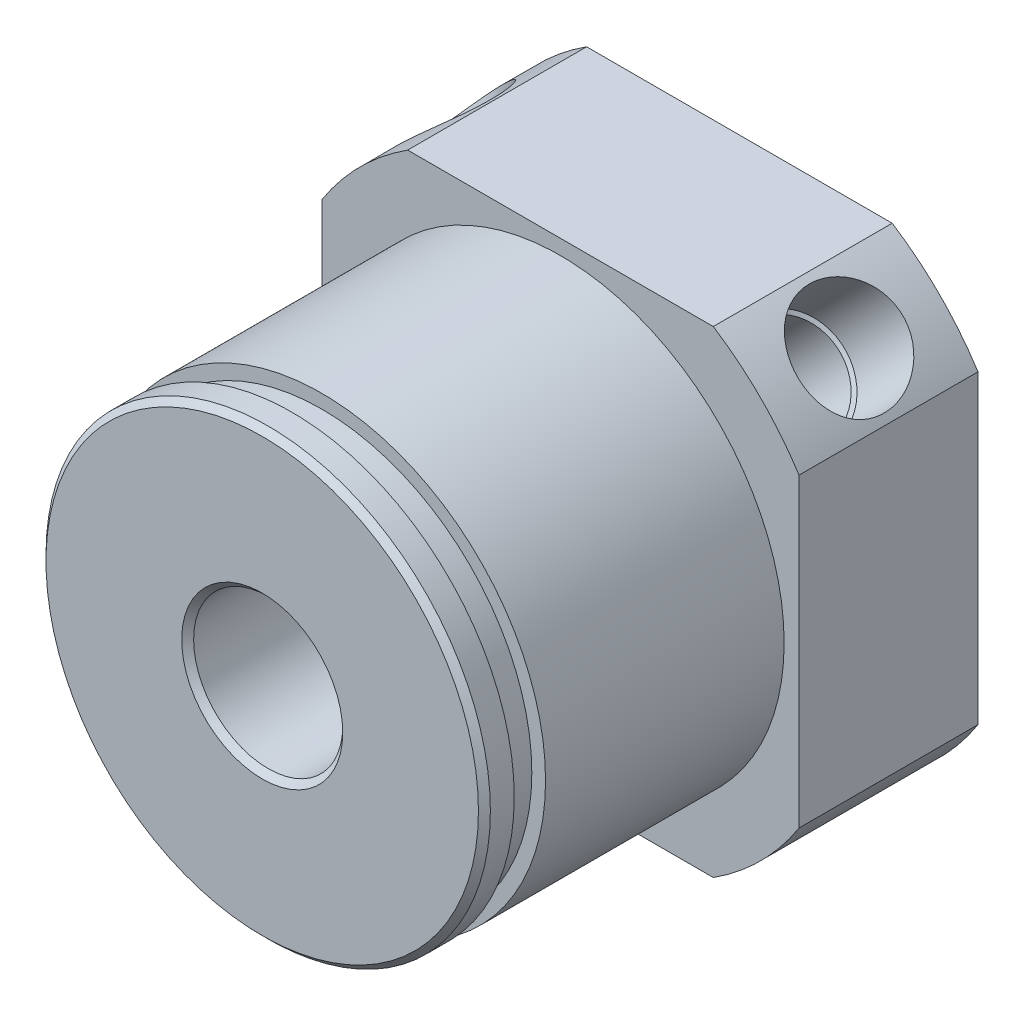
from build123d import *

# Parameters (mm, degrees)
BOSS_EXTRUDE1_DEPTH         = 7.62
CUT_EXTRUDE1_START          = 1.523953
CUT_EXTRUDE1_DEPTH          = 0.508
F_1_4_0_25_DIAMETER_HOLE1_D = 6.35
CHAMFER1_SIZE               = 0.254


# Read off the part's stored shape, not the designer's step: CSK for #6 Flat Head Machine Screw (100)1, CSK for #6 Flat Head Machine Screw (100)2
with BuildPart() as part:
    # Sketch1 → Boss-Extrude1 (new body)
    with BuildSketch(Plane(origin=(0, 0, 0), x_dir=(-1, 0, 0), z_dir=(0, 0, -1))):
        with BuildLine():
            Line((10.16, -6.506813736), (10.16, 6.506813736))
            ThreePointArc((10.16, 6.506813736), (8.531243315, 8.531243315), (6.506813736, 10.16))
            Line((6.506813736, 10.16), (-6.506813736, 10.16))
            ThreePointArc((-6.506813736, 10.16), (-8.531243315, 8.531243315), (-10.16, 6.506813736))
            Line((-10.16, 6.506813736), (-10.16, -6.506813736))
            ThreePointArc((-10.16, -6.506813736), (-8.531243315, -8.531243315), (-6.506813736, -10.16))
            Line((-6.506813736, -10.16), (6.506813736, -10.16))
            ThreePointArc((6.506813736, -10.16), (8.531243315, -8.531243315), (10.16, -6.506813736))
        make_face()
    extrude(amount=-BOSS_EXTRUDE1_DEPTH)

    # Sketch2 → Cut-Extrude1 (cut)
    with BuildSketch(Plane(origin=(0, 0, 1.523952559), x_dir=(-1, 0, 0), z_dir=(0, 0, -1)).offset(CUT_EXTRUDE1_START)):
        with BuildLine():
            Line((1.889125, -8.001), (1.158875, -8.001))
            add(Edge.make_bspline(
                [(1.158875, -8.001), (1.158872937, -8.044475215), (1.158868812, -8.131425646), (1.158899751, -8.261853836), (1.158782182, -8.392271851), (1.159221519, -8.522728024), (1.157581766, -8.65303983), (1.163686315, -8.783563395), (1.131096282, -8.911728677), (1.058473502, -9.021898611), (0.953640515, -9.101760404), (0.829437405, -9.145385371), (0.697588706, -9.145896155), (0.573131645, -9.103398602), (0.467813448, -9.024298708), (0.394265073, -8.914779016), (0.360421234, -8.786730663), (0.366393811, -8.655863654), (0.36478471, -8.525077993), (0.365216149, -8.394030645), (0.365100694, -8.26302727), (0.365131077, -8.132012169), (0.365127026, -8.044670723), (0.365125, -8.001)],
                knots=[0, 0, 0, 0, 0.04771921, 0.095438419, 0.143157629, 0.190876839, 0.238596048, 0.286313163, 0.333682366, 0.381043764, 0.428414282, 0.475836339, 0.523086151, 0.570387621, 0.617736793, 0.665150189, 0.712504193, 0.760330872, 0.808264698, 0.856198523, 0.904132349, 0.952066174, 1, 1, 1, 1], degree=3))
            Line((0.365125, -8.001), (-1.889125, -8.001))
            add(Edge.make_bspline(
                [(-1.889125, -8.001), (-1.889114812, -8.051894525), (-1.889094436, -8.153683576), (-1.889247255, -8.306368158), (-1.888666545, -8.459048717), (-1.890836563, -8.611744064), (-1.882759373, -8.763965749), (-1.914911349, -8.916005254), (-2.006583536, -9.041712954), (-2.136758982, -9.125851008), (-2.289345509, -9.153077401), (-2.441459117, -9.123368959), (-2.569808734, -9.037082272), (-2.65983821, -8.910286231), (-2.688880942, -8.757615863), (-2.681256155, -8.60511048), (-2.683310175, -8.451698443), (-2.682753256, -8.298343213), (-2.682926802, -8.144961863), (-2.682789537, -7.991619884), (-2.683165051, -7.838146541), (-2.681801975, -7.685351504), (-2.686853196, -7.53117355), (-2.628890851, -7.38497772), (-2.521046133, -7.273065177), (-2.378348767, -7.206351642), (-2.223808502, -7.207490017), (-2.072112792, -7.207185716), (-1.919779713, -7.207267225), (-1.767631713, -7.207245385), (-1.615434122, -7.207251236), (-1.463249814, -7.20724967), (-1.311061964, -7.207250082), (-1.209603988, -7.207250027), (-1.158875, -7.20725)],
                knots=[0, 0, 0, 0, 0.031320452, 0.062640904, 0.093961356, 0.125281809, 0.156602077, 0.187665627, 0.218747437, 0.249771849, 0.28082955, 0.311809013, 0.342800401, 0.373834649, 0.404881688, 0.436337896, 0.467799211, 0.499260526, 0.530721841, 0.562183156, 0.593644471, 0.625105786, 0.656448512, 0.68765108, 0.718839254, 0.750218434, 0.781469964, 0.81268854, 0.843907117, 0.875125693, 0.90634427, 0.937562847, 0.968781423, 1, 1, 1, 1], degree=3))
            add(Edge.make_bspline(
                [(-1.158875, -7.20725), (-1.158873643, -7.162894388), (-1.158870928, -7.074183165), (-1.158891289, -6.941111847), (-1.158813917, -6.808058432), (-1.159103046, -6.674937496), (-1.158160413, -6.542105789), (-1.162792352, -6.40859388), (-1.123081204, -6.279296809), (-1.043328982, -6.17099473), (-0.932633409, -6.094593309), (-0.802795792, -6.059099197), (-0.668632801, -6.067681678), (-0.544609192, -6.120335348), (-0.445331921, -6.210309856), (-0.378114798, -6.328380261), (-0.369456887, -6.416856776), (-0.365125, -6.461125)],
                knots=[0, 0, 0, 0, 0.066968294, 0.133936588, 0.200904882, 0.267873219, 0.334841936, 0.401752492, 0.468337617, 0.534646563, 0.601246412, 0.66759139, 0.734141278, 0.800523112, 0.867014877, 0.933462398, 1, 1, 1, 1], degree=3))
            Line((-0.365125, -6.461125), (-0.365125, -7.20725))
            add(Edge.make_bspline(
                [(-0.365125, -7.20725), (-0.31073924, -7.20725), (-0.20196772, -7.20725), (-0.03881044, -7.20725), (0.124346841, -7.20725), (0.287504121, -7.20725), (0.450661401, -7.207250001), (0.61381868, -7.207249996), (0.776975966, -7.207250014), (0.940133226, -7.207249949), (1.103290581, -7.207250189), (1.26644758, -7.207249293), (1.42960591, -7.207252638), (1.59275927, -7.207240153), (1.755931181, -7.207286749), (1.91903386, -7.207112852), (2.082398735, -7.207761857), (2.244713636, -7.205340907), (2.410623595, -7.213297949), (2.556377817, -7.298886101), (2.658013084, -7.432947287), (2.689729238, -7.59799594), (2.681031241, -7.762226985), (2.683361321, -7.927506447), (2.682773435, -8.092675694), (2.682794937, -8.257881374), (2.683296815, -8.423048668), (2.68126756, -8.588352833), (2.688866329, -8.75283629), (2.658381139, -8.918643331), (2.555396264, -9.053764707), (2.408701771, -9.136770112), (2.2405432, -9.153020414), (2.080098519, -9.09990658), (1.955237034, -8.986695), (1.885247755, -8.831155243), (1.890172169, -8.664016711), (1.888843871, -8.498928973), (1.889199968, -8.332843432), (1.889106258, -8.166945119), (1.889118753, -8.05631504), (1.889125, -8.001)],
                knots=[0, 0, 0, 0, 0.025504461, 0.051008922, 0.076513383, 0.102017844, 0.127522304, 0.153026765, 0.178531226, 0.204035687, 0.229540148, 0.255044609, 0.28054907, 0.306053531, 0.331557991, 0.357062452, 0.382566913, 0.408073163, 0.433537274, 0.459042456, 0.484570707, 0.510085466, 0.535909525, 0.561732239, 0.587554953, 0.613377667, 0.639200381, 0.665023095, 0.690855069, 0.716494274, 0.742192433, 0.767783402, 0.793488921, 0.819098849, 0.844763736, 0.870443974, 0.896243874, 0.922182905, 0.948121937, 0.974060968, 1, 1, 1, 1], degree=3))
        make_face()
    extrude(amount=-CUT_EXTRUDE1_DEPTH, mode=Mode.SUBTRACT)

    # Sketch3 → Revolve1 (revolve)
    with BuildSketch(Plane.XZ, mode=Mode.PRIVATE) as revolve1_sk:
        Polygon((9.4615, 20.32), (0, 20.32), (0, 7.62), (9.525, 7.62), (9.525, 17.78), (8.9408, 17.78), (8.9408, 19.05), (9.4615, 19.05), align=None)
    revolve(revolve1_sk.sketch.rotate(Axis((0, 0, 20.32), (0, 0, -1)), 180), axis=Axis((0, 0, 20.32), (0, 0, -1)))

    # 1/4 (0.25) Diameter Hole1 (through all)
    with Locations(Plane(origin=(0, 0, 0), x_dir=(-1, 0, 0), z_dir=(0, 0, -1))):
        with Locations((0, 0)):
            Hole(F_1_4_0_25_DIAMETER_HOLE1_D / 2)

    # CSK for _6 Flat Head Machine Screw _ 2 → CSK for _6 Flat Head Machine Screw _100 (revolve, cut)
    with BuildSketch(Plane(origin=(0, 0, 3.81), x_dir=(0.7071067811866009, 0.7071067811864942, 0), z_dir=(0, 0, -1))):
        Polygon((2.0828, -8.509), (2.0828, -2.395972613), (0, -2.395972613), (0, -12.065031051), (2.2479, -12.065031051), (2.2479, -8.577386659), align=None)
    revolve(axis=Axis((0, 0, 3.81), (0.7071067811864942, -0.7071067811866009, 0)), mode=Mode.SUBTRACT)

    # CSK for _6 Flat Head Machine Screw _ 3 o → CSK for _6 Flat Head Machine Screw _ 3 (revolve, cut)
    with BuildSketch(Plane(origin=(0, 0, 3.81), x_dir=(0.707106781186431, -0.707106781186664, 0), z_dir=(0, 0, 1))):
        Polygon((0, 2.395972613), (2.0828, 2.395972613), (2.0828, 8.509), (2.2479, 8.577386659), (2.2479, 12.065031051), (0, 12.065031051), align=None)
    revolve(axis=Axis((0, 0, 3.81), (0.707106781186664, 0.707106781186431, 0)), mode=Mode.SUBTRACT)

    # Chamfer1
    chamfer1_edges = [part.edges().sort_by_distance(p)[0] for p in [
        (9.4615, 0, 20.32),
        (-3.175, 0, 0),
        (-3.175, 0, 20.32),
    ]]
    chamfer(chamfer1_edges, length=CHAMFER1_SIZE)


solid = part.part
